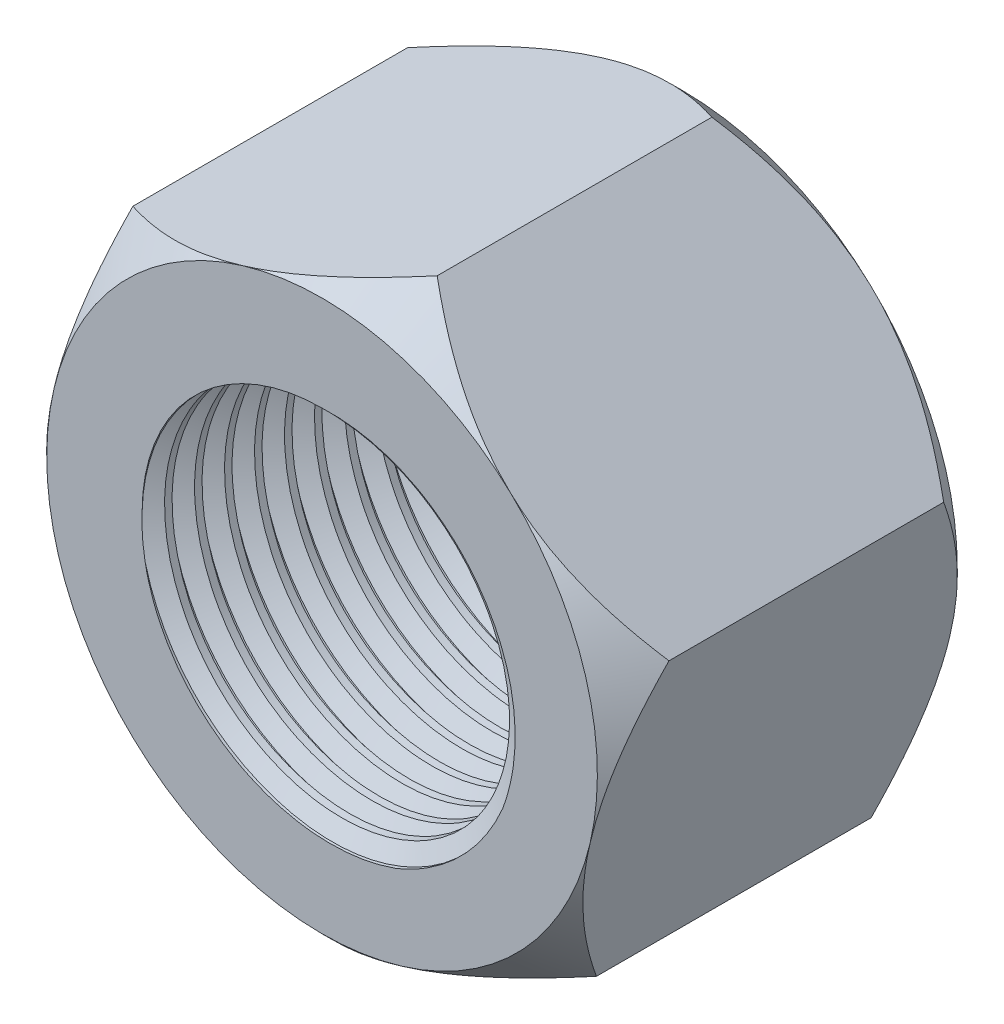
from build123d import *

# Parameters (mm, degrees)
SKETCH1_R               = 1.5
BOSS_EXTRUDE1_DEPTH     = 1.5
SKETCH2_OUTSIDE_W       = 18.64
SKETCH2_OUTSIDE_H       = 18.726
SKETCH2_OUTSIDE_R       = 2.29496732
CUT_EXTRUDE2_DEPTH      = 5
CUT_EXTRUDE2_DRAFT      = -45
MIRROR3_COPY_1_SKETCH_W = 18.64
MIRROR3_COPY_1_SKETCH_H = 18.726
MIRROR3_COPY_1_SKETCH_R = 2.29496732
MIRROR3_COPY_1_DEPTH    = 5
MIRROR3_COPY_1_DRAFT    = -45
THREAD1_PITCH           = 0.25


with BuildPart() as part:
    # Sketch1 → Boss-Extrude1 (new, symmetric)
    with BuildSketch(Plane.XY):
        Polygon((-1.932166989, 1.813623645), (-2.536727644, -0.766493875), (-0.604560655, -2.58011752), (1.932166989, -1.813623645), (2.536727644, 0.766493875), (0.604560655, 2.58011752), align=None)
        Circle(SKETCH1_R, mode=Mode.SUBTRACT)
    extrude(amount=BOSS_EXTRUDE1_DEPTH, both=True)


with BuildPart() as cut_extrude2_tool:
    # Sketch2 outside → Cut-Extrude2 (with draft: the straight prism first)
    with BuildSketch(Plane.XY.offset(1.5)):
        Rectangle(SKETCH2_OUTSIDE_W, SKETCH2_OUTSIDE_H)
        Circle(SKETCH2_OUTSIDE_R, mode=Mode.SUBTRACT)
    extrude(amount=-CUT_EXTRUDE2_DEPTH)
    # Cut-Extrude2: the draft: its side faces are tilted about the plane it starts from
    cut_extrude2_sides = [cut_extrude2_tool.faces().sort_by_distance(p)[0] for p in [
        (0, -9.363, -1),
        (9.32, 0, -1),
        (0, 9.363, -1),
        (-9.32, 0, -1),
        (-2.29496732, 0, -1),
    ]]
    draft(cut_extrude2_sides, Plane.XY.offset(1.5), CUT_EXTRUDE2_DRAFT)


with BuildPart() as part_1:
    add(part.part)

    # Cut-Extrude2: cut by cut_extrude2_tool
    add(cut_extrude2_tool.part, mode=Mode.SUBTRACT)


with BuildPart() as mirror3_copy_1_tool:
    # Mirror3 copy 1 sketch → Mirror3 copy 1 (with draft: the straight prism first)
    with BuildSketch(Plane(origin=(0, 0, -1.5), x_dir=(1, 0, 0), z_dir=(0, 0, -1))):
        Rectangle(MIRROR3_COPY_1_SKETCH_W, MIRROR3_COPY_1_SKETCH_H)
        Circle(MIRROR3_COPY_1_SKETCH_R, mode=Mode.SUBTRACT)
    extrude(amount=-MIRROR3_COPY_1_DEPTH)
    # Mirror3 copy 1: the draft: its side faces are tilted about the plane it starts from
    mirror3_copy_1_sides = [mirror3_copy_1_tool.faces().sort_by_distance(p)[0] for p in [
        (0, -9.363, 1),
        (9.32, 0, 1),
        (0, 9.363, 1),
        (-9.32, 0, 1),
        (-2.29496732, 0, 1),
    ]]
    draft(mirror3_copy_1_sides, Plane(origin=(0, 0, -1.5), x_dir=(1, 0, 0), z_dir=(0, 0, -1)), MIRROR3_COPY_1_DRAFT)


with BuildPart() as part_2:
    add(part_1.part)

    # Mirror3 copy 1: cut by mirror3_copy_1_tool
    add(mirror3_copy_1_tool.part, mode=Mode.SUBTRACT)

    # Thread1: the profile of Thread Profile1 profile screwed along a right-hand helix of 40 turns, 6 arcs to a turn; built about Z, then put on its axis
    thread1_z = Axis((0, 0, 0), (0, 0, 1))
    thread1_corners = [(1.4997, 0, -0.000173205), (1.635316469, 0, 0.078125), (1.635316469, 0, 0.109375), (1.4997, 0, 0.187673204)]
    with BuildLine(mode=Mode.PRIVATE) as thread1_profile:
        Line(thread1_corners[0], thread1_corners[1])
        Line(thread1_corners[1], thread1_corners[2])
        Line(thread1_corners[2], thread1_corners[3])
        Line(thread1_corners[3], thread1_corners[0])
    thread1_cap = Face(thread1_profile.wire())
    thread1_turn_angles = [0, 30, 60, 90, 120, 150, 180, 210, 240, 270, 300, 330, 360, 390, 420, 450, 480, 510, 540, 570, 600, 630, 660, 690, 720]
    thread1_turn_weights = [1, 0.8660254037844387, 1, 0.8660254037844387, 1, 0.8660254037844387, 1, 0.8660254037844387, 1, 0.8660254037844387, 1, 0.8660254037844387, 1, 0.8660254037844387, 1, 0.8660254037844387, 1, 0.8660254037844387, 1, 0.8660254037844387, 1, 0.8660254037844387, 1, 0.8660254037844387, 1]
    thread1_turn_rails = [Edge.make_bspline([Vector(p[0], p[1], 0).rotate(thread1_z, thread1_turn_angles[k]) / thread1_turn_weights[k] + Vector(0, 0, p[2] + THREAD1_PITCH * thread1_turn_angles[k] / 360) for k in range(25)], [0, 0, 0, 1, 1, 2, 2, 3, 3, 4, 4, 5, 5, 6, 6, 7, 7, 8, 8, 9, 9, 10, 10, 11, 11, 12, 12, 12], 2, thread1_turn_weights) for p in thread1_corners]
    thread1_turn_sides = [Face.make_surface_from_curves(thread1_turn_rails[p[0]], thread1_turn_rails[p[1]]) for p in [(0, 1), (1, 2), (2, 3), (3, 0)]]
    thread1 = Plane(origin=(0, 0, 4.5), x_dir=(-1, 0, 0), z_dir=(0, 0, -1)) * Solid(Shell([*[p.moved(Location((0, 0, 2 * THREAD1_PITCH * i))) for i in range(20) for p in thread1_turn_sides], thread1_cap, thread1_cap.rotate(thread1_z, 14400).moved(Location((0, 0, THREAD1_PITCH * 14400 / 360)))]))
    add(thread1, mode=Mode.SUBTRACT)


solid = part_2.part
